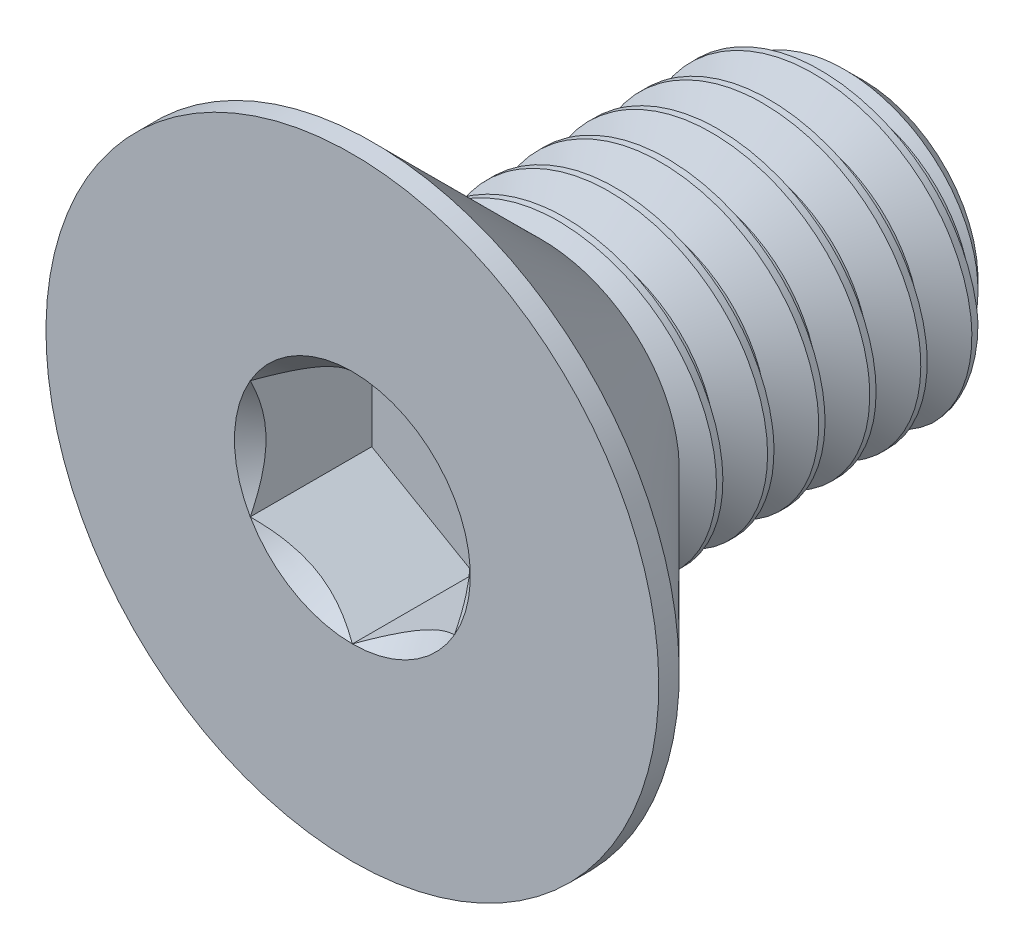
from build123d import *
from build123d.topology import SkipClean

# Parameters (mm, degrees)
SKETCH1_W          = 5
SKETCH1_H          = 1.5
CHAMFER1_SIZE      = 0.375
CUT_SWEEP1_PITCH   = 0.5
CUT_EXTRUDE2_DEPTH = 1.19


with BuildPart() as part:
    # Sketch1 → Revolve1 (revolve)
    with BuildSketch(Plane(origin=(0, 0, 0), x_dir=(0, 0, -1), z_dir=(1, 0, 0))):
        with Locations((2.5, 0.75)):
            Rectangle(SKETCH1_W, SKETCH1_H)
    revolve(axis=Axis((0, 0, -5), (0, 0, 1)))

    # Chamfer1
    chamfer1_edges = [part.edges().sort_by_distance(p)[0] for p in [
        (0, -1.5, -5),
    ]]
    chamfer(chamfer1_edges, length=CHAMFER1_SIZE)

    # Cut-Sweep1: arcs per turn and ends read off the stored shape
    # Cut-Sweep1: the profile of Sketch2 profile screwed along a right-hand helix through 11 turns, 6 arcs to a turn; built about Z, then put on its axis
    cut_sweep1_z = Axis((0, 0, 0), (0, 0, 1))
    cut_sweep1_corners = [(1.5006, 0, 0.00034641), (1.5006, 0, -0.43784641), (1.175240474, 0, -0.25), (1.175240474, 0, -0.1875)]
    with BuildLine(mode=Mode.PRIVATE) as cut_sweep1_profile:
        Line(cut_sweep1_corners[0], cut_sweep1_corners[1])
        Line(cut_sweep1_corners[1], cut_sweep1_corners[2])
        Line(cut_sweep1_corners[2], cut_sweep1_corners[3])
        Line(cut_sweep1_corners[3], cut_sweep1_corners[0])
    cut_sweep1_cap = Face(cut_sweep1_profile.wire())
    cut_sweep1_turn_angles = [0, 30, 60, 90, 120, 150, 180, 210, 240, 270, 300, 330, 360]
    cut_sweep1_turn_weights = [1, 0.8660254037844387, 1, 0.8660254037844387, 1, 0.8660254037844387, 1, 0.8660254037844387, 1, 0.8660254037844387, 1, 0.8660254037844387, 1]
    cut_sweep1_turn_rails = [Edge.make_bspline([Vector(p[0], p[1], 0).rotate(cut_sweep1_z, cut_sweep1_turn_angles[k]) / cut_sweep1_turn_weights[k] + Vector(0, 0, p[2] + CUT_SWEEP1_PITCH * cut_sweep1_turn_angles[k] / 360) for k in range(13)], [0, 0, 0, 1, 1, 2, 2, 3, 3, 4, 4, 5, 5, 6, 6, 6], 2, cut_sweep1_turn_weights) for p in cut_sweep1_corners]
    cut_sweep1_turn_sides = [Face.make_surface_from_curves(cut_sweep1_turn_rails[p[0]], cut_sweep1_turn_rails[p[1]]) for p in [(0, 1), (1, 2), (2, 3), (3, 0)]]
    cut_sweep1 = Plane(origin=(0, 0, -5), x_dir=(0, 1, 0), z_dir=(0, 0, 1)) * Solid(Shell([*[p.moved(Location((0, 0, CUT_SWEEP1_PITCH * i))) for i in range(11) for p in cut_sweep1_turn_sides], cut_sweep1_cap, cut_sweep1_cap.rotate(cut_sweep1_z, 3960).moved(Location((0, 0, CUT_SWEEP1_PITCH * 3960 / 360)))]))
    add(cut_sweep1, mode=Mode.SUBTRACT)

    # Sketch7 → Revolve2 (revolve)
    with BuildSketch(Plane(origin=(0, 0, 0), x_dir=(0, 0, -1), z_dir=(1, 0, 0)), mode=Mode.PRIVATE) as revolve2_sk:
        Polygon((0, 3), (0.2, 3), (1.7, 1.5), (1.7, 0), (0, 0), align=None)
    revolve(revolve2_sk.sketch.rotate(Axis((0, 0, 0), (0, 0, -1)), 180), axis=Axis((0, 0, 0), (0, 0, -1)))

    # Boss-Extrude1 cone 1 section (through the dimple's axis) → Boss-Extrude1 (revolve)
    with SkipClean():  # the faces are left unmerged after this step: merging them gives an invalid solid
        with BuildSketch(Plane(origin=(0, 0, -1.7), x_dir=(0, -1, 0), z_dir=(1, 0, 0))):
            Polygon((0, 0), (1.5, 0), (0, 1.5), align=None)
        revolve(axis=Axis((0, 0, -1.7), (0, 0, -1)))

    # Sketch5 → Cut-Extrude2 (cut)
    with SkipClean():  # the faces are left unmerged after this step: merging them gives an invalid solid
        with BuildSketch(Plane.XY):
            Polygon((1, -0.577350269), (1, 0.577350269), (0, 1.154700538), (-1, 0.577350269), (-1, -0.577350269), (0, -1.154700538), align=None)
        extrude(amount=-CUT_EXTRUDE2_DEPTH, mode=Mode.SUBTRACT)

    # Cut-Extrude3 cone 1 section (through the dimple's axis) → Cut-Extrude3 (revolve, cut)
    with SkipClean():  # the faces are left unmerged after this step: merging them gives an invalid solid
        with BuildSketch(Plane(origin=(0, 0, 0), x_dir=(0, -1, 0), z_dir=(1, 0, 0))):
            Polygon((0, 0), (1.154700538, 0), (0, 1.154700538), align=None)
        revolve(axis=Axis((0, 0, 0), (0, 0, -1)), mode=Mode.SUBTRACT)


solid = part.part
